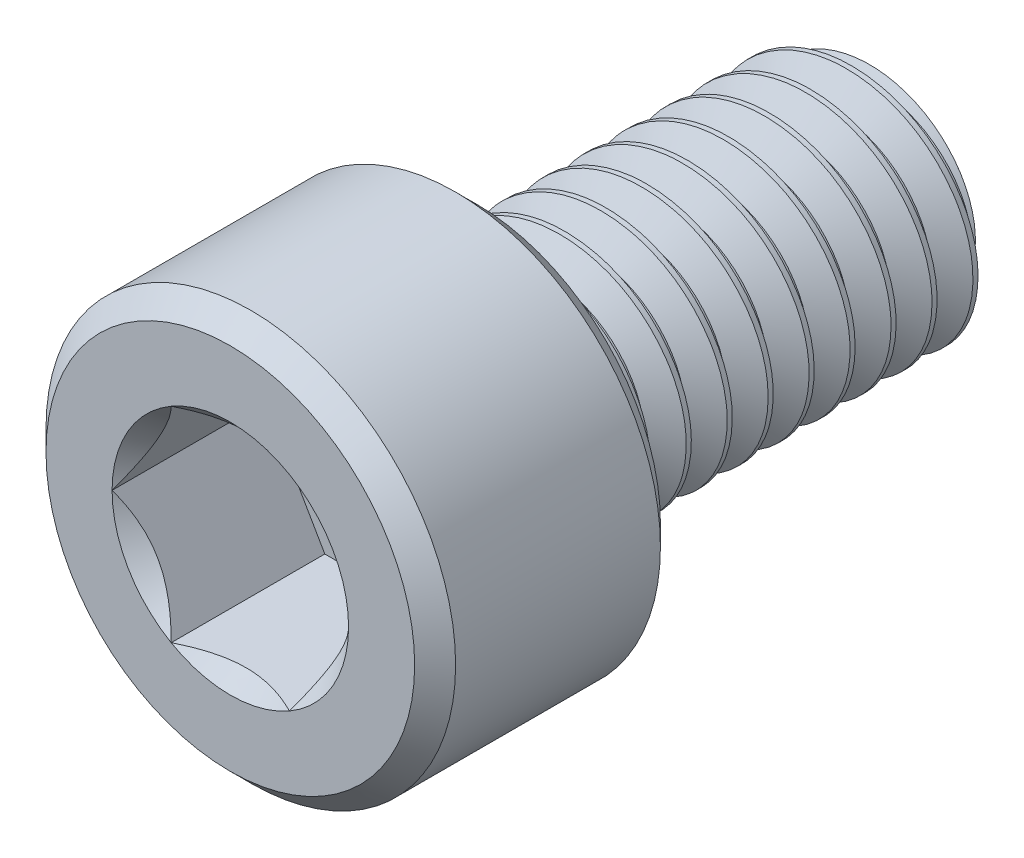
from build123d import *

# Parameters (mm, degrees)
SKETCH1_R           = 3
BOSS_EXTRUDE1_DEPTH = 10
CUT_SWEEP1_PITCH    = 1
SKETCH5_R           = 5
BOSS_EXTRUDE2_DEPTH = 6
CUT_EXTRUDE1_DEPTH  = 3.75
CHAMFER1_SIZE       = 0.5


with BuildPart() as part:
    # Sketch1 → Boss-Extrude1 (new body)
    with BuildSketch(Plane.XY):
        Circle(SKETCH1_R)
    extrude(amount=BOSS_EXTRUDE1_DEPTH)

    # Cut-Sweep1: the profile of Sketch3 screwed along a right-hand helix of 45 turns, 8 arcs to a turn; built about Z, then put on its axis
    cut_sweep1_z = Axis((0, 0, 0), (0, 0, 1))
    cut_sweep1_corners = [(3, 0, 0), (3, 0.046355005, -0.873771259), (2.350480947, 0.026488574, -0.499297862), (2.350480947, 0.019866431, -0.374473397)]
    with BuildLine(mode=Mode.PRIVATE) as cut_sweep1_profile:
        Line(cut_sweep1_corners[0], cut_sweep1_corners[1])
        Line(cut_sweep1_corners[1], cut_sweep1_corners[2])
        Line(cut_sweep1_corners[2], cut_sweep1_corners[3])
        Line(cut_sweep1_corners[3], cut_sweep1_corners[0])
    cut_sweep1_cap = Face(cut_sweep1_profile.wire())
    cut_sweep1_turn_angles = [0, 22.5, 45, 67.5, 90, 112.5, 135, 157.5, 180, 202.5, 225, 247.5, 270, 292.5, 315, 337.5, 360, 382.5, 405, 427.5, 450, 472.5, 495, 517.5, 540, 562.5, 585, 607.5, 630, 652.5, 675, 697.5, 720]
    cut_sweep1_turn_weights = [1, 0.9238795325112867, 1, 0.9238795325112867, 1, 0.9238795325112867, 1, 0.9238795325112867, 1, 0.9238795325112867, 1, 0.9238795325112867, 1, 0.9238795325112867, 1, 0.9238795325112867, 1, 0.9238795325112867, 1, 0.9238795325112867, 1, 0.9238795325112867, 1, 0.9238795325112867, 1, 0.9238795325112867, 1, 0.9238795325112867, 1, 0.9238795325112867, 1, 0.9238795325112867, 1]
    cut_sweep1_turn_rails = [Edge.make_bspline([Vector(p[0], p[1], 0).rotate(cut_sweep1_z, cut_sweep1_turn_angles[k]) / cut_sweep1_turn_weights[k] + Vector(0, 0, p[2] + CUT_SWEEP1_PITCH * cut_sweep1_turn_angles[k] / 360) for k in range(33)], [0, 0, 0, 1, 1, 2, 2, 3, 3, 4, 4, 5, 5, 6, 6, 7, 7, 8, 8, 9, 9, 10, 10, 11, 11, 12, 12, 13, 13, 14, 14, 15, 15, 16, 16, 16], 2, cut_sweep1_turn_weights) for p in cut_sweep1_corners]
    cut_sweep1_turn_sides = [Face.make_surface_from_curves(cut_sweep1_turn_rails[p[0]], cut_sweep1_turn_rails[p[1]]) for p in [(0, 1), (1, 2), (2, 3), (3, 0)]]
    cut_sweep1_last_angles = [15840, 15862.5, 15885, 15907.5, 15930, 15952.5, 15975, 15997.5, 16020, 16042.5, 16065, 16087.5, 16110, 16132.5, 16155, 16177.5, 16200]
    cut_sweep1_last_weights = [1, 0.9238795325112867, 1, 0.9238795325112867, 1, 0.9238795325112867, 1, 0.9238795325112867, 1, 0.9238795325112867, 1, 0.9238795325112867, 1, 0.9238795325112867, 1, 0.9238795325107279, 1]
    cut_sweep1_last_rails = [Edge.make_bspline([Vector(p[0], p[1], 0).rotate(cut_sweep1_z, cut_sweep1_last_angles[k]) / cut_sweep1_last_weights[k] + Vector(0, 0, p[2] + CUT_SWEEP1_PITCH * cut_sweep1_last_angles[k] / 360) for k in range(17)], [0, 0, 0, 1, 1, 2, 2, 3, 3, 4, 4, 5, 5, 6, 6, 7, 7, 8, 8, 8], 2, cut_sweep1_last_weights) for p in cut_sweep1_corners]
    cut_sweep1_last_sides = [Face.make_surface_from_curves(cut_sweep1_last_rails[p[0]], cut_sweep1_last_rails[p[1]]) for p in [(0, 1), (1, 2), (2, 3), (3, 0)]]
    cut_sweep1 = Plane(origin=(0, 0, 0), x_dir=(0, 1, 0), z_dir=(0, 0, 1)) * Solid(Shell([*[p.moved(Location((0, 0, 2 * CUT_SWEEP1_PITCH * i))) for i in range(22) for p in cut_sweep1_turn_sides], *cut_sweep1_last_sides, cut_sweep1_cap, cut_sweep1_cap.rotate(cut_sweep1_z, 16200).moved(Location((0, 0, CUT_SWEEP1_PITCH * 16200 / 360)))]))
    add(cut_sweep1, mode=Mode.SUBTRACT)

    # Sketch4 → Cut-Revolve1 (revolve, cut)
    with BuildSketch(Plane(origin=(0, 0, 0), x_dir=(0, 0, -1), z_dir=(1, 0, 0)), mode=Mode.PRIVATE) as cut_revolve1_sk:
        Polygon((0, 4), (-1.33285839, 4), (0, 2.096480947), align=None)
    revolve(cut_revolve1_sk.sketch.rotate(Axis((0, 0, 0), (0, 0, -1)), 90), axis=Axis((0, 0, 0), (0, 0, -1)), mode=Mode.SUBTRACT)

    # Sketch5 → Boss-Extrude2 (add)
    with BuildSketch(Plane.XY.offset(10)):
        Circle(SKETCH5_R)
    extrude(amount=BOSS_EXTRUDE2_DEPTH)

    # Sketch6 → Cut-Extrude1 (cut)
    with BuildSketch(Plane.XY.offset(16)):
        Polygon((1.443375673, 2.5), (-1.443375673, 2.5), (-2.886751346, 0), (-1.443375673, -2.5), (1.443375673, -2.5), (2.886751346, 0), align=None)
    extrude(amount=-CUT_EXTRUDE1_DEPTH, mode=Mode.SUBTRACT)

    # Cut-Extrude2 cone 1 section (through the dimple's axis) → Cut-Extrude2 (revolve, cut)
    with BuildSketch(Plane(origin=(0, 0, 16), x_dir=(0, -1, 0), z_dir=(1, 0, 0))):
        Polygon((0, 0), (2.886751346, 0), (0, 2.886751346), align=None)
    revolve(axis=Axis((0, 0, 16), (0, 0, -1)), mode=Mode.SUBTRACT)

    # Chamfer1
    chamfer1_edges = [part.edges().sort_by_distance(p)[0] for p in [
        (-5, 0, 10),
        (-5, 0, 16),
    ]]
    chamfer(chamfer1_edges, length=CHAMFER1_SIZE)


solid = part.part
